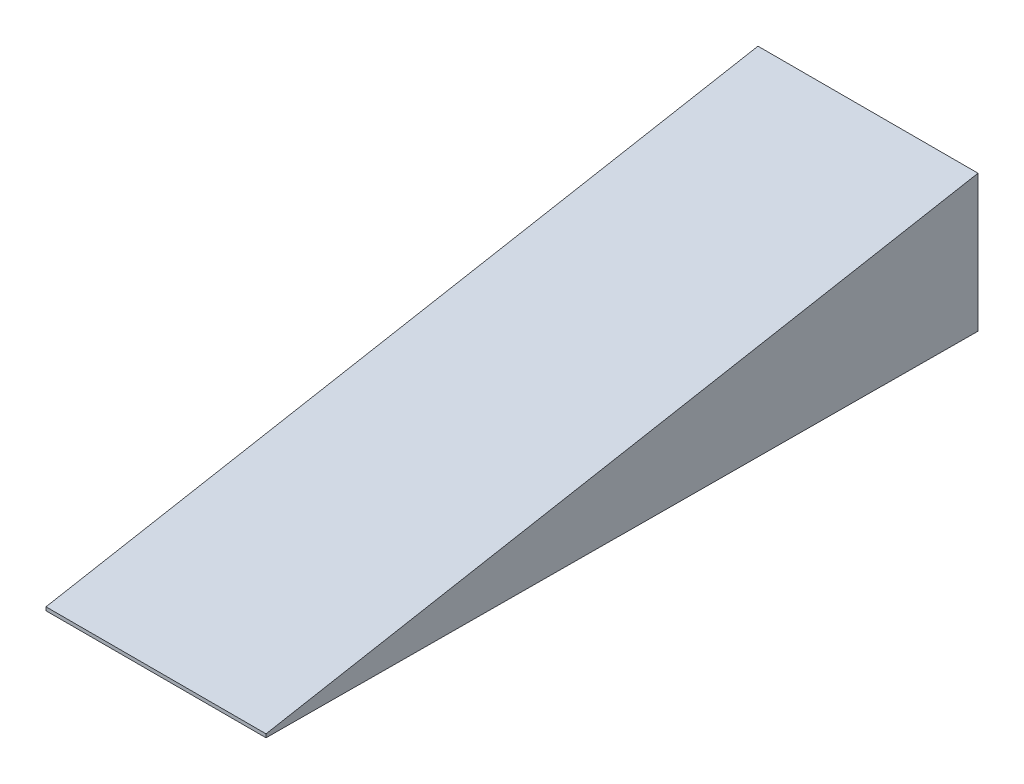
from build123d import *

# Parameters (mm, degrees)
SHELL1_T = -3.175


with BuildPart() as part:
    # Sketch1 → Loft1 section 0
    with BuildSketch(Plane.XY):
        with BuildLine():
            Line((20.1168, 12.5095), (-20.1168, 12.5095))
            Line((-20.1168, 12.5095), (-20.1168, -12.5095))
            Line((-20.1168, -12.5095), (20.1168, -12.5095))
            Line((20.1168, -12.5095), (20.1168, 12.5095))
        make_face()
    # 3DSketch1 → Loft1 section 1
    with BuildSketch(Plane(origin=(-20.1168, -11.811, 130.175), x_dir=(0.9998754744294865, 0.015780862917132092, 0), z_dir=(0, 0, 1))):
        with BuildLine():
            Line((0, 0), (40.228589888, -0.634920926))
            Line((40.228589888, -0.634920926), (40.238610736, 0))
            Line((40.238610736, 0), (0.010020848, 0.634920926))
            Line((0.010020848, 0.634920926), (0, 0))
        make_face()
    loft()

    # Shell1
    shell1_openings = [part.faces().sort_by_distance(p)[0] for p in [
        (0, 0, 0),
    ]]
    offset(amount=SHELL1_T, openings=shell1_openings, kind=Kind.INTERSECTION)


solid = part.part
